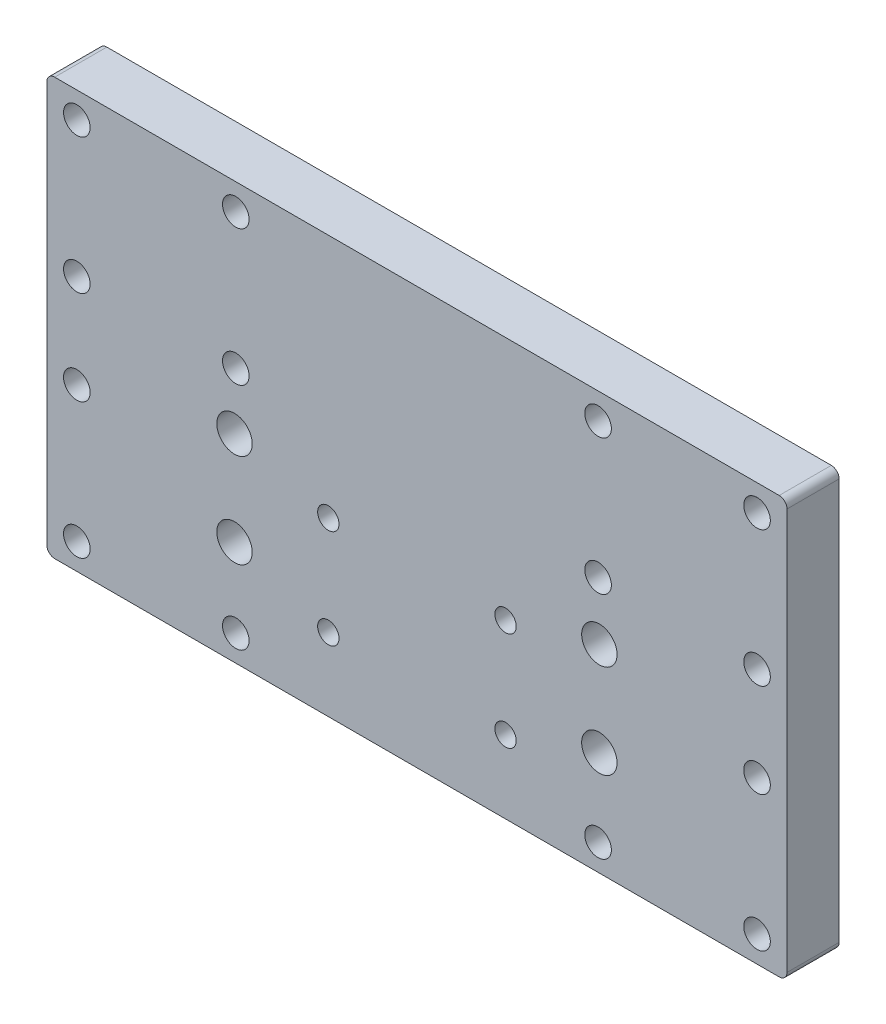
from build123d import *

# Parameters (mm, degrees)
SKETCH1_W           = 142
SKETCH1_H           = 80
BOSS_EXTRUDE1_DEPTH = 5
SKETCH2_R           = 2.55
CUT_EXTRUDE1_DEPTH  = 83.1035931
SKETCH3_R           = 2.05
CUT_EXTRUDE2_DEPTH  = 83.1035931
SKETCH4_R           = 3.4
CUT_EXTRUDE3_DEPTH  = 83.1035931
FILLET1_R           = 1.5


with BuildPart() as part:
    # Sketch1 → Boss-Extrude1 (new, symmetric)
    with BuildSketch(Plane.XY):
        Rectangle(SKETCH1_W, SKETCH1_H)
    extrude(amount=BOSS_EXTRUDE1_DEPTH, both=True)

    # Sketch2 → Cut-Extrude1 (cut, through all)
    with BuildSketch(Plane.XY.offset(5)):
        with Locations((-65.25, 35)):
            Circle(SKETCH2_R)
        with Locations((-34.75, 35)):
            Circle(SKETCH2_R)
        with Locations((-34.75, 9)):
            Circle(SKETCH2_R)
        with Locations((-65.25, 9)):
            Circle(SKETCH2_R)
        with Locations((65.25, 35)):
            Circle(SKETCH2_R)
        with Locations((65.25, 9)):
            Circle(SKETCH2_R)
        with Locations((34.75, 9)):
            Circle(SKETCH2_R)
        with Locations((34.75, 35)):
            Circle(SKETCH2_R)
        with Locations((-65.25, -9)):
            Circle(SKETCH2_R)
        with Locations((-34.75, -35)):
            Circle(SKETCH2_R)
        with Locations((-65.25, -35)):
            Circle(SKETCH2_R)
        with Locations((65.25, -9)):
            Circle(SKETCH2_R)
        with Locations((65.25, -35)):
            Circle(SKETCH2_R)
        with Locations((34.75, -35)):
            Circle(SKETCH2_R)
    extrude(amount=-CUT_EXTRUDE1_DEPTH, mode=Mode.SUBTRACT)

    # Sketch3 → Cut-Extrude2 (cut, through all)
    with BuildSketch(Plane.XY.offset(5)):
        with Locations((-17, -7)):
            Circle(SKETCH3_R)
        with Locations((-17, -26)):
            Circle(SKETCH3_R)
        with Locations((17, -26)):
            Circle(SKETCH3_R)
        with Locations((17, -7)):
            Circle(SKETCH3_R)
    extrude(amount=-CUT_EXTRUDE2_DEPTH, mode=Mode.SUBTRACT)

    # Sketch4 → Cut-Extrude3 (cut, through all)
    with BuildSketch(Plane.XY.offset(5)):
        with Locations((-35, -2)):
            Circle(SKETCH4_R)
        with Locations((35, -2)):
            Circle(SKETCH4_R)
        with Locations((35, -20)):
            Circle(SKETCH4_R)
        with Locations((-35, -20)):
            Circle(SKETCH4_R)
    extrude(amount=-CUT_EXTRUDE3_DEPTH, mode=Mode.SUBTRACT)

    # Fillet1
    fillet1_edges = [part.edges().sort_by_distance(p)[0] for p in [
        (-71, -40, 0),
        (71, -40, 0),
        (71, 40, 0),
        (-71, 40, 0),
    ]]
    fillet(fillet1_edges, radius=FILLET1_R)


solid = part.part
